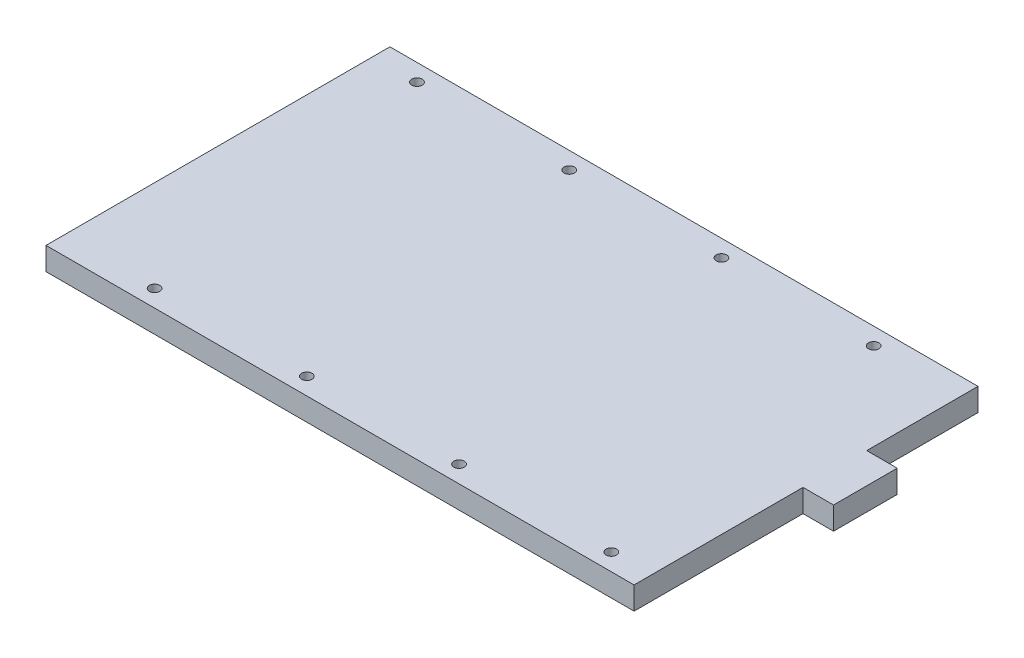
from build123d import *

# Parameters (mm, degrees)
SKETCH1_R           = 2.75
BOSS_EXTRUDE1_DEPTH = 12


with BuildPart() as part:
    # Sketch1 → Boss-Extrude1 (new body)
    with BuildSketch(Plane(origin=(0, 0, 0), x_dir=(1, 0, 0), z_dir=(0, 1, 0))):
        Polygon((155, 90.65), (-155, 90.65), (-155, -90.65), (155, -90.65), (155, -1.585790321), (171.07879109, -1.585790321), (171.07879109, 31.995651769), (155, 31.995651769), align=None)
        with Locations((-106.75, -81.65)):
            Circle(SKETCH1_R, mode=Mode.SUBTRACT)
        with Locations((-26.5, -81.65)):
            Circle(SKETCH1_R, mode=Mode.SUBTRACT)
        with Locations((53.75, -81.65)):
            Circle(SKETCH1_R, mode=Mode.SUBTRACT)
        with Locations((134, -81.65)):
            Circle(SKETCH1_R, mode=Mode.SUBTRACT)
        with Locations((-131.75, 81.65)):
            Circle(SKETCH1_R, mode=Mode.SUBTRACT)
        with Locations((-51.5, 81.65)):
            Circle(SKETCH1_R, mode=Mode.SUBTRACT)
        with Locations((28.75, 81.65)):
            Circle(SKETCH1_R, mode=Mode.SUBTRACT)
        with Locations((109, 81.65)):
            Circle(SKETCH1_R, mode=Mode.SUBTRACT)
    extrude(amount=BOSS_EXTRUDE1_DEPTH)


solid = part.part
